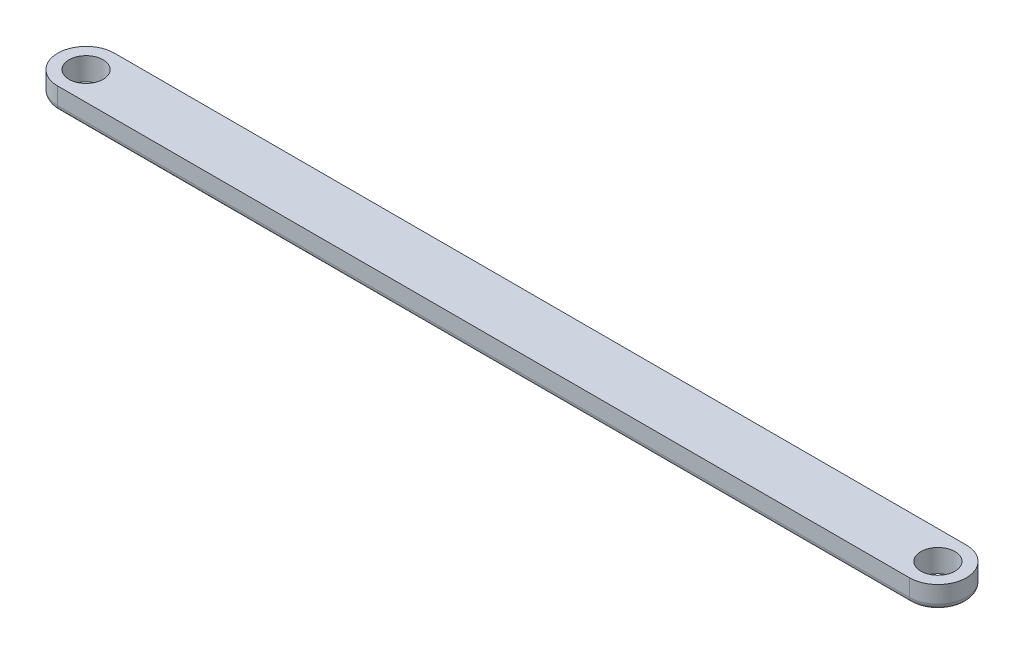
from build123d import *

# Parameters (mm, degrees)
SKETCH1_R           = 3
BOSS_EXTRUDE1_DEPTH = 4
FILLET1_R           = 1


with BuildPart() as part:
    # Sketch1 → Boss-Extrude1 (new body)
    with BuildSketch(Plane(origin=(0, 0, 0), x_dir=(1, 0, 0), z_dir=(0, 1, 0))):
        with BuildLine():
            Line((150, 5), (0, 5))
            ThreePointArc((0, 5), (-5, 0), (0, -5))
            Line((0, -5), (150, -5))
            ThreePointArc((150, -5), (155, 0), (150, 5))
        make_face()
        with Locations((150, 0)):
            Circle(SKETCH1_R, mode=Mode.SUBTRACT)
        Circle(SKETCH1_R, mode=Mode.SUBTRACT)
    extrude(amount=BOSS_EXTRUDE1_DEPTH)

    # Fillet1
    fillet1_edges = [part.edges().sort_by_distance(p)[0] for p in [
        (155, 0, 0),
        (75, 0, -5),
        (-5, 0, 0),
        (75, 0, 5),
    ]]
    fillet(fillet1_edges, radius=FILLET1_R)


solid = part.part
